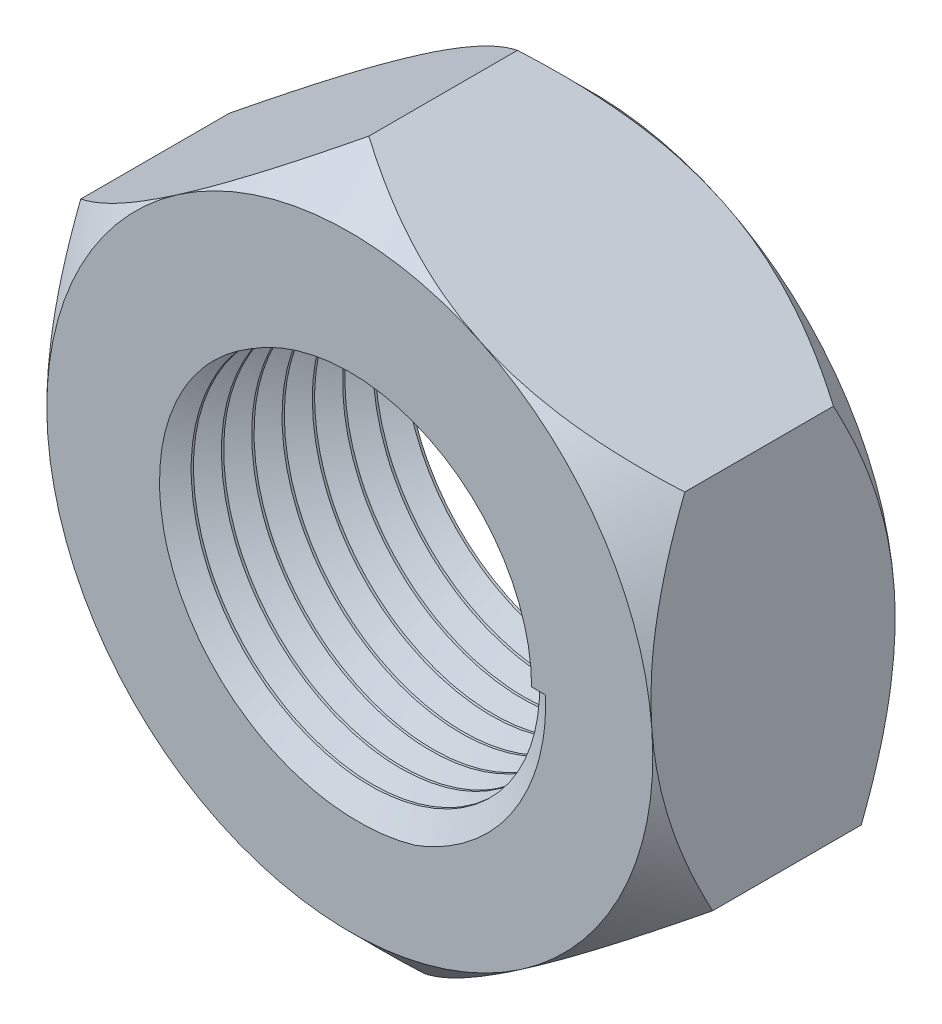
from build123d import *

# Parameters (mm, degrees)
ESQUISSE1_R                           = 1.5
BOSS_EXTRU_1_DEPTH                    = 1
ENL_VEMENT_DE_MATI_RE_BALAYAGE1_PITCH = 0.25
ESQUISSE4_OUTSIDE_W                   = 28.818
ESQUISSE4_OUTSIDE_H                   = 29.36
ESQUISSE4_OUTSIDE_R                   = 2.5
ENL_V_MAT_EXTRU_1_DEPTH               = 10
ENL_V_MAT_EXTRU_1_DRAFT               = -45
SYM_TRIE1_COPY_1_SKETCH_W             = 28.818
SYM_TRIE1_COPY_1_SKETCH_H             = 29.36
SYM_TRIE1_COPY_1_SKETCH_R             = 2.5
SYM_TRIE1_COPY_1_DEPTH                = 10
SYM_TRIE1_COPY_1_DRAFT                = -45


with BuildPart() as part:
    # Esquisse1 → Boss.-Extru.1 (new, symmetric)
    with BuildSketch(Plane.XY):
        Polygon((2.377103432, 1.637898839), (-0.229910287, 2.877581379), (-2.607013719, 1.239682541), (-2.377103432, -1.637898839), (0.229910287, -2.877581379), (2.607013719, -1.239682541), align=None)
        Circle(ESQUISSE1_R, mode=Mode.SUBTRACT)
    extrude(amount=BOSS_EXTRU_1_DEPTH, both=True)

    # Enlèvement de matière-Balayage1: arcs per turn and ends read off the stored shape
    # Enlèvement de matière-Balayage1: the profile of Esquisse3 screwed along a right-hand helix through 61 turns, 6 arcs to a turn; built about Z, then put on its axis
    enl_vement_de_mati_re_balayage1_z = Axis((0, 0, 0), (0, 0, 1))
    enl_vement_de_mati_re_balayage1_corners = [(1.7, -2.97e-07, -0.049330782), (1.325, -2.31e-07, -0.265837133), (1.325, -2.31e-07, 0.167175569)]
    with BuildLine(mode=Mode.PRIVATE) as enl_vement_de_mati_re_balayage1_profile:
        Line(enl_vement_de_mati_re_balayage1_corners[0], enl_vement_de_mati_re_balayage1_corners[1])
        Line(enl_vement_de_mati_re_balayage1_corners[1], enl_vement_de_mati_re_balayage1_corners[2])
        Line(enl_vement_de_mati_re_balayage1_corners[2], enl_vement_de_mati_re_balayage1_corners[0])
    enl_vement_de_mati_re_balayage1_cap = Face(enl_vement_de_mati_re_balayage1_profile.wire())
    enl_vement_de_mati_re_balayage1_turn_angles = [0, 30, 60, 90, 120, 150, 180, 210, 240, 270, 300, 330, 360]
    enl_vement_de_mati_re_balayage1_turn_weights = [1, 0.8660254037844387, 1, 0.8660254037844387, 1, 0.8660254037844387, 1, 0.8660254037844387, 1, 0.8660254037844387, 1, 0.8660254037844387, 1]
    enl_vement_de_mati_re_balayage1_turn_rails = [Edge.make_bspline([Vector(p[0], p[1], 0).rotate(enl_vement_de_mati_re_balayage1_z, enl_vement_de_mati_re_balayage1_turn_angles[k]) / enl_vement_de_mati_re_balayage1_turn_weights[k] + Vector(0, 0, p[2] + ENL_VEMENT_DE_MATI_RE_BALAYAGE1_PITCH * enl_vement_de_mati_re_balayage1_turn_angles[k] / 360) for k in range(13)], [0, 0, 0, 1, 1, 2, 2, 3, 3, 4, 4, 5, 5, 6, 6, 6], 2, enl_vement_de_mati_re_balayage1_turn_weights) for p in enl_vement_de_mati_re_balayage1_corners]
    enl_vement_de_mati_re_balayage1_turn_sides = [Face.make_surface_from_curves(enl_vement_de_mati_re_balayage1_turn_rails[p[0]], enl_vement_de_mati_re_balayage1_turn_rails[p[1]]) for p in [(0, 1), (1, 2), (2, 0)]]
    enl_vement_de_mati_re_balayage1 = Plane(origin=(0, 0, 1), x_dir=(1, 0, 0), z_dir=(0, 0, -1)) * Solid(Shell([*[p.moved(Location((0, 0, ENL_VEMENT_DE_MATI_RE_BALAYAGE1_PITCH * i))) for i in range(61) for p in enl_vement_de_mati_re_balayage1_turn_sides], enl_vement_de_mati_re_balayage1_cap, enl_vement_de_mati_re_balayage1_cap.rotate(enl_vement_de_mati_re_balayage1_z, 21960).moved(Location((0, 0, ENL_VEMENT_DE_MATI_RE_BALAYAGE1_PITCH * 21960 / 360)))]))
    add(enl_vement_de_mati_re_balayage1, mode=Mode.SUBTRACT)


with BuildPart() as enl_v_mat_extru_1_tool:
    # Esquisse4 outside → Enlèv. mat.-Extru.1 (with draft: the straight prism first)
    with BuildSketch(Plane.XY.offset(1)):
        Rectangle(ESQUISSE4_OUTSIDE_W, ESQUISSE4_OUTSIDE_H)
        Circle(ESQUISSE4_OUTSIDE_R, mode=Mode.SUBTRACT)
    extrude(amount=-ENL_V_MAT_EXTRU_1_DEPTH)
    # Enlèv. mat.-Extru.1: the draft: its side faces are tilted about the plane it starts from
    enl_v_mat_extru_1_sides = [enl_v_mat_extru_1_tool.faces().sort_by_distance(p)[0] for p in [
        (0, -14.68, -4),
        (14.409, 0, -4),
        (0, 14.68, -4),
        (-14.409, 0, -4),
        (-2.5, 0, -4),
    ]]
    draft(enl_v_mat_extru_1_sides, Plane.XY.offset(1), ENL_V_MAT_EXTRU_1_DRAFT)


with BuildPart() as part_1:
    add(part.part)

    # Enlèv. mat.-Extru.1: cut by enl_v_mat_extru_1_tool
    add(enl_v_mat_extru_1_tool.part, mode=Mode.SUBTRACT)


with BuildPart() as sym_trie1_copy_1_tool:
    # Symétrie1 copy 1 sketch → Symétrie1 copy 1 (with draft: the straight prism first)
    with BuildSketch(Plane(origin=(0, 0, -1), x_dir=(1, 0, 0), z_dir=(0, 0, -1))):
        Rectangle(SYM_TRIE1_COPY_1_SKETCH_W, SYM_TRIE1_COPY_1_SKETCH_H)
        Circle(SYM_TRIE1_COPY_1_SKETCH_R, mode=Mode.SUBTRACT)
    extrude(amount=-SYM_TRIE1_COPY_1_DEPTH)
    # Symétrie1 copy 1: the draft: its side faces are tilted about the plane it starts from
    sym_trie1_copy_1_sides = [sym_trie1_copy_1_tool.faces().sort_by_distance(p)[0] for p in [
        (0, -14.68, 4),
        (14.409, 0, 4),
        (0, 14.68, 4),
        (-14.409, 0, 4),
        (-2.5, 0, 4),
    ]]
    draft(sym_trie1_copy_1_sides, Plane(origin=(0, 0, -1), x_dir=(1, 0, 0), z_dir=(0, 0, -1)), SYM_TRIE1_COPY_1_DRAFT)


with BuildPart() as part_2:
    add(part_1.part)

    # Symétrie1 copy 1: cut by sym_trie1_copy_1_tool
    add(sym_trie1_copy_1_tool.part, mode=Mode.SUBTRACT)


solid = part_2.part
